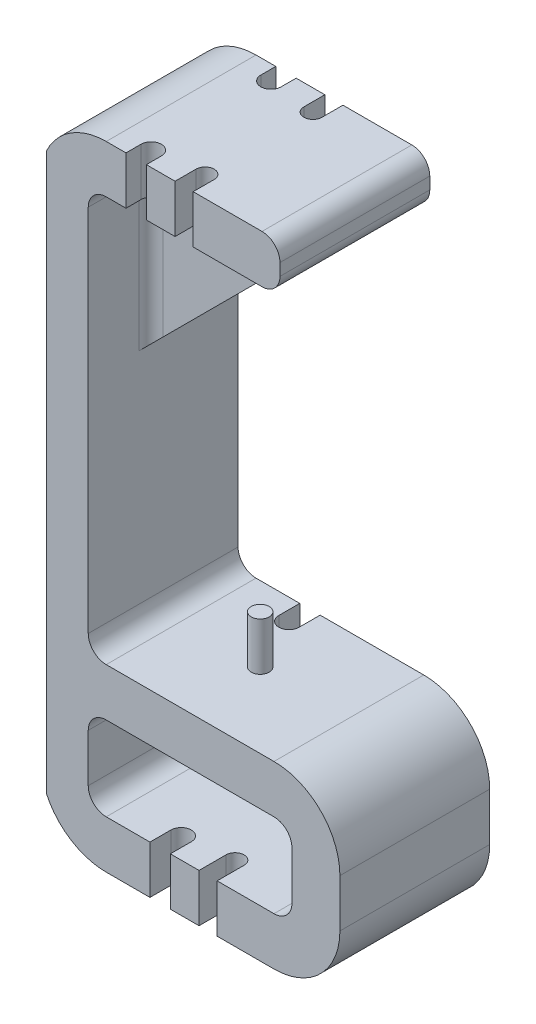
from build123d import *

# Parameters (mm, degrees)
BOSS_EXTRUDE2_DEPTH = 12.5
BOSS_EXTRUDE3_DEPTH = 25
FILLET3_R           = 3
FILLET4_R           = 11
CUT_EXTRUDE2_REACH  = 111.246
CUT_EXTRUDE3_REACH  = 111.246
CUT_EXTRUDE7_REACH  = 111.246
BOSS_EXTRUDE5_DEPTH = 2
FILLET6_R           = 2
FILLET7_R           = 3
CUT_EXTRUDE4_REACH  = 111.246
CUT_EXTRUDE6_REACH  = 111.246
SKETCH26_R          = 1.5
BOSS_EXTRUDE6_DEPTH = 8
CUT_EXTRUDE8_DEPTH  = 2
SKETCH30_W          = 25
SKETCH30_H          = 105.61
CUT_EXTRUDE9_DEPTH  = 1


with BuildPart() as part:
    # Sketch6 → Boss-Extrude2 (new, symmetric)
    with BuildSketch(Plane.XY):
        Polygon((-25, 52.805), (15, 52.805), (15, 44.805), (-17, 44.805), (-17, -44.805), (25, -44.805), (25, -52.805), (-25, -52.805), align=None)
    extrude(amount=BOSS_EXTRUDE2_DEPTH, both=True)

    # Sketch15 → Boss-Extrude3 (add)
    with BuildSketch(Plane.XY.offset(12.5)):
        Polygon((-17, -22.805), (25, -22.805), (25, -52.805), (17, -52.805), (17, -30.805), (-17, -30.805), align=None)
    extrude(amount=-BOSS_EXTRUDE3_DEPTH)

    # Fillet3
    fillet3_edges = [part.edges().sort_by_distance(p)[0] for p in [
        (-17, 44.805, 0),
        (-17, -44.805, 0),
        (17, -30.805, 0),
        (17, -44.805, 0),
        (-17, -22.805, 0),
        (-17, -30.805, 0),
    ]]
    fillet(fillet3_edges, radius=FILLET3_R)

    # Fillet4
    fillet4_edges = [part.edges().sort_by_distance(p)[0] for p in [
        (-25, 52.805, 0),
        (25, -52.805, 0),
        (-25, -52.805, 0),
        (25, -22.805, 0),
    ]]
    fillet(fillet4_edges, radius=FILLET4_R)

    # Sketch20 → Cut-Extrude2 (cut, up to next)
    with BuildSketch(Plane(origin=(0, 52.805, 0), x_dir=(1, 0, 0), z_dir=(0, 1, 0)), mode=Mode.PRIVATE) as cut_extrude2_sk1:
        with BuildLine():
            Line((-10.7, 12.5), (-10.7, 10))
            ThreePointArc((-10.7, 10), (-9, 8.3), (-7.3, 10))
            Line((-7.3, 10), (-7.3, 12.5))
            Line((-7.3, 12.5), (-10.7, 12.5))
        make_face()
    cut_extrude2_tool1 = extrude(cut_extrude2_sk1.sketch, amount=-CUT_EXTRUDE2_REACH, mode=Mode.PRIVATE) & part.part
    # Sketch20 → Cut-Extrude2 (cut, up to next)
    with BuildSketch(Plane(origin=(0, 52.805, 0), x_dir=(1, 0, 0), z_dir=(0, 1, 0)), mode=Mode.PRIVATE) as cut_extrude2_sk2:
        with BuildLine():
            Line((-7.3, -12.5), (-10.7, -12.5))
            Line((-10.7, -12.5), (-10.7, -10))
            ThreePointArc((-10.7, -10), (-9, -8.3), (-7.3, -10))
            Line((-7.3, -10), (-7.3, -12.5))
        make_face()
    cut_extrude2_tool2 = extrude(cut_extrude2_sk2.sketch, amount=-CUT_EXTRUDE2_REACH, mode=Mode.PRIVATE) & part.part
    add(cut_extrude2_tool1.solids().sort_by_distance((-9, 52.805, -10.563642))[0], mode=Mode.SUBTRACT)
    add(cut_extrude2_tool2.solids().sort_by_distance((-9, 52.805, 10.563642))[0], mode=Mode.SUBTRACT)

    # Cut-Extrude3: up to this face of the body (flat: up to its plane)
    cut_extrude3_end = Plane(part.part.faces().sort_by_distance((0, -22.805, 0))[0])
    # Sketch21 → Cut-Extrude3 (cut, up to the picked face)
    with BuildSketch(Plane.XZ.offset(52.805), mode=Mode.PRIVATE) as cut_extrude3_sk1:
        with BuildLine():
            Line((-3.3, -12.5), (-6.7, -12.5))
            Line((-6.7, -12.5), (-6.7, -9))
            ThreePointArc((-6.7, -9), (-5, -7.3), (-3.3, -9))
            Line((-3.3, -9), (-3.3, -12.5))
        make_face()
    cut_extrude3_tool1 = split(extrude(cut_extrude3_sk1.sketch, amount=-CUT_EXTRUDE3_REACH, mode=Mode.PRIVATE), bisect_by=cut_extrude3_end, keep=Keep.BOTH, mode=Mode.PRIVATE)
    add(cut_extrude3_tool1.solids().sort_by(Axis((-5, -52.805, -10.067524), (0, 1, 0)))[0], mode=Mode.SUBTRACT)

    # Sketch25 → Cut-Extrude7 (cut, up to next)
    with BuildSketch(Plane.XZ.offset(52.805), mode=Mode.PRIVATE) as cut_extrude7_sk1:
        with BuildLine():
            Line((-3.3, 9), (-3.3, 12.5))
            Line((-3.3, 12.5), (-6.7, 12.5))
            Line((-6.7, 12.5), (-6.7, 9))
            ThreePointArc((-6.7, 9), (-5, 7.3), (-3.3, 9))
        make_face()
    cut_extrude7_tool1 = extrude(cut_extrude7_sk1.sketch, amount=-CUT_EXTRUDE7_REACH, mode=Mode.PRIVATE) & part.part
    add(cut_extrude7_tool1.solids().sort_by_distance((-5, -52.805, 10.067524))[0], mode=Mode.SUBTRACT)

    # Sketch22 → Boss-Extrude5 (add, symmetric)
    with BuildSketch(Plane.XY):
        with BuildLine():
            Line((11, 44.805), (-17, 16.805))
            Line((-17, 16.805), (-17, 41.805))
            ThreePointArc((-17, 41.805), (-16.121320344, 43.926320344), (-14, 44.805))
            Line((-14, 44.805), (11, 44.805))
        make_face()
    extrude(amount=BOSS_EXTRUDE5_DEPTH, both=True)

    # Fillet6
    fillet6_edges = [part.edges().sort_by_distance(p)[0] for p in [
        (-1.5, 44.805, -2),
        (-16.121320344, 43.926320344, -2),
        (-17, 29.305, -2),
        (-1.5, 44.805, 2),
        (-16.121320344, 43.926320344, 2),
        (-17, 29.305, 2),
    ]]
    fillet(fillet6_edges, radius=FILLET6_R)

    # Fillet7
    fillet7_edges = [part.edges().sort_by_distance(p)[0] for p in [
        (15, 52.805, 0),
        (15, 44.805, 0),
    ]]
    fillet(fillet7_edges, radius=FILLET7_R)

    # Sketch23 → Cut-Extrude4 (cut, up to next)
    with BuildSketch(Plane(origin=(0, 52.805, 0), x_dir=(1, 0, 0), z_dir=(0, 1, 0)), mode=Mode.PRIVATE) as cut_extrude4_sk1:
        with BuildLine():
            Line((-2.51, 12.5), (-2.51, 9))
            ThreePointArc((-2.51, 9), (-1, 7.49), (0.51, 9))
            Line((0.51, 9), (0.51, 12.5))
            Line((0.51, 12.5), (-2.51, 12.5))
        make_face()
    cut_extrude4_tool1 = extrude(cut_extrude4_sk1.sketch, amount=-CUT_EXTRUDE4_REACH, mode=Mode.PRIVATE) & part.part
    # Sketch23 → Cut-Extrude4 (cut, up to next)
    with BuildSketch(Plane(origin=(0, 52.805, 0), x_dir=(1, 0, 0), z_dir=(0, 1, 0)), mode=Mode.PRIVATE) as cut_extrude4_sk2:
        with BuildLine():
            Line((0.51, -12.5), (-2.51, -12.5))
            Line((-2.51, -12.5), (-2.51, -9))
            ThreePointArc((-2.51, -9), (-1, -7.49), (0.51, -9))
            Line((0.51, -9), (0.51, -12.5))
        make_face()
    cut_extrude4_tool2 = extrude(cut_extrude4_sk2.sketch, amount=-CUT_EXTRUDE4_REACH, mode=Mode.PRIVATE) & part.part
    add(cut_extrude4_tool1.solids().sort_by_distance((-1, 52.805, -10.144905))[0], mode=Mode.SUBTRACT)
    add(cut_extrude4_tool2.solids().sort_by_distance((-1, 52.805, 10.144905))[0], mode=Mode.SUBTRACT)

    # Sketch24 → Cut-Extrude6 (cut, up to next)
    with BuildSketch(Plane.XZ.offset(52.805), mode=Mode.PRIVATE) as cut_extrude6_sk1:
        with BuildLine():
            Line((1.49, -12.5), (1.49, -8))
            ThreePointArc((1.49, -8), (3, -6.49), (4.51, -8))
            Line((4.51, -8), (4.51, -12.5))
            Line((4.51, -12.5), (1.49, -12.5))
        make_face()
    cut_extrude6_tool1 = extrude(cut_extrude6_sk1.sketch, amount=-CUT_EXTRUDE6_REACH, mode=Mode.PRIVATE) & part.part
    # Sketch24 → Cut-Extrude6 (cut, up to next)
    with BuildSketch(Plane.XZ.offset(52.805), mode=Mode.PRIVATE) as cut_extrude6_sk2:
        with BuildLine():
            Line((4.51, 12.5), (1.49, 12.5))
            Line((1.49, 12.5), (1.49, 8))
            ThreePointArc((1.49, 8), (3, 6.49), (4.51, 8))
            Line((4.51, 8), (4.51, 12.5))
        make_face()
    cut_extrude6_tool2 = extrude(cut_extrude6_sk2.sketch, amount=-CUT_EXTRUDE6_REACH, mode=Mode.PRIVATE) & part.part
    add(cut_extrude6_tool1.solids().sort_by_distance((3, -52.805, -9.647036))[0], mode=Mode.SUBTRACT)
    add(cut_extrude6_tool2.solids().sort_by_distance((3, -52.805, 9.647036))[0], mode=Mode.SUBTRACT)

    # Sketch26 → Boss-Extrude6 (add)
    with BuildSketch(Plane(origin=(0, -22.805, 0), x_dir=(1, 0, 0), z_dir=(0, 1, 0))):
        with Locations(Location((-0.8, 0, 0), (0, 0, 270))):
            Circle(SKETCH26_R)
    extrude(amount=BOSS_EXTRUDE6_DEPTH)

    # Sketch29 → Cut-Extrude8 (cut)
    with BuildSketch(Plane.ZY.offset(25)):
        Polygon((1.25, 37.916111111), (2.5, 37.916111111), (2.256944444, 37.638333333), (1.423611111, 37.638333333), align=None)
        Polygon((0, 37.916111111), (1.180555556, 37.916111111), (1.006944444, 37.638333333), (0.243055556, 37.638333333), align=None)
        Polygon((1.180555556, 36.4925), (0, 36.4925), (0.243055556, 36.770277778), (1.006944444, 36.770277778), align=None)
        Polygon((2.5, 36.4925), (1.25, 36.4925), (1.423611111, 36.770277778), (2.256944444, 36.770277778), align=None)
        Polygon((1.216362847, 37.811944444), (1.355251736, 37.603611111), (1.355251736, 36.805), (1.217447917, 36.596666667), (1.077473958, 36.805), (1.077473958, 37.603611111), align=None)
        Polygon((1.041666667, 35.207777778), (0.243055556, 35.207777778), (0, 35.345581597), (0.243055556, 35.485555556), (1.041666667, 35.485555556), align=None)
        Polygon((2.5, 36.075833333), (2.256944444, 35.798055556), (1.423611111, 35.798055556), (1.306966146, 36.054674479), (1.319444444, 36.075833333), align=None)
        Polygon((2.5, 34.6175), (1.319444444, 34.6175), (1.306966146, 34.638658854), (1.423611111, 34.895277778), (2.256944444, 34.895277778), align=None)
        Polygon((1.251085069, 35.971666667), (1.388888889, 35.763333333), (1.388888889, 34.93), (1.251085069, 34.721666667), (1.111111111, 34.93), (1.111111111, 35.763333333), align=None)
        Polygon((1.284722222, 34.235555556), (2.465277778, 34.235555556), (2.1875, 33.957777778), (1.458333333, 33.957777778), align=None)
        Polygon((0, 34.235555556), (1.215277778, 34.235555556), (1.041666667, 33.957777778), (0.243055556, 33.957777778), align=None)
        Polygon((2.5, 33.124444444), (2.362196181, 33.020277778), (2.222222222, 33.124444444), (2.222222222, 33.923055556), (2.5, 34.200833333), align=None)
        Polygon((2.1875, 32.811944444), (1.319444444, 32.811944444), (1.306966146, 32.833103299), (1.458333333, 33.089722222), (2.1875, 33.089722222), (2.291666667, 32.951918403), align=None)
        Polygon((1.251085069, 34.131388889), (1.389973958, 33.923055556), (1.389973958, 33.124444444), (1.252170139, 32.916111111), (1.112196181, 33.124444444), (1.112196181, 33.923055556), align=None)
        Polygon((1.284722222, 32.291111111), (2.430555556, 32.291111111), (2.1875, 32.013333333), (1.458333333, 32.013333333), align=None)
        Polygon((0.069444444, 32.291111111), (1.215277778, 32.291111111), (1.041666667, 32.013333333), (0.3125, 32.013333333), align=None)
        Polygon((2.5, 30.971666667), (2.222222222, 31.249444444), (2.222222222, 31.978611111), (2.5, 32.256388889), align=None)
        Polygon((0, 30.971666667), (0, 32.256388889), (0.277777778, 31.978611111), (0.277777778, 31.249444444), align=None)
        Polygon((1.251085069, 32.186944444), (1.389973958, 31.978611111), (1.389973958, 31.249444444), (1.251085069, 31.006388889), (1.112196181, 31.249444444), (1.112196181, 31.978611111), align=None)
        Polygon((0.999348958, 29.443888889), (-0.025499132, 29.009861111), (0.243055556, 29.415677083), (0.999348958, 29.740655382), align=None)
        Polygon((1.284722222, 30.589722222), (2.465277778, 30.589722222), (2.1875, 30.311944444), (1.458333333, 30.311944444), align=None)
        Polygon((-0.034722222, 30.589722222), (1.215277778, 30.589722222), (1.041666667, 30.311944444), (0.243055556, 30.311944444), align=None)
        Polygon((2.5, 29.513333333), (2.362196181, 29.409166667), (2.222222222, 29.513333333), (2.222222222, 30.277222222), (2.5, 30.555), align=None)
        Polygon((2.1875, 29.200833333), (1.319444444, 29.200833333), (1.306966146, 29.221992187), (1.458333333, 29.478611111), (2.1875, 29.478611111), (2.291666667, 29.340807292), align=None)
        Polygon((1.251085069, 30.52624566), (1.389973958, 30.277222222), (1.389973958, 29.513333333), (1.252170139, 29.305), (1.112196181, 29.513333333), (1.112196181, 30.277222222), align=None)
        Polygon((1.255967882, 28.575833333), (1.388888889, 28.311076389), (1.388888889, 27.703980035), (1.255967882, 27.43), (1.111111111, 27.703980035), (1.111111111, 28.311076389), align=None)
        Polygon((2.465277778, 25.450833333), (2.259657118, 25.450833333), (1.423611111, 26.28796441), (1.423611111, 26.4925), (1.629231771, 26.4925), (2.465277778, 25.655368924), align=None)
        Polygon((1.25, 26.874444444), (2.5, 26.874444444), (2.256944444, 26.596666667), (1.423611111, 26.596666667), align=None)
        Polygon((0, 26.874444444), (1.180555556, 26.874444444), (1.006944444, 26.596666667), (0.243055556, 26.596666667), align=None)
        Polygon((0.243055556, 25.728611111), (1.041666667, 25.728611111), (1.158311632, 25.471992187), (1.145833333, 25.450833333), (0, 25.450833333), align=None)
        Polygon((1.216362847, 26.770277778), (1.355251736, 26.561944444), (1.355251736, 25.763333333), (1.217447917, 25.555), (1.077473958, 25.763333333), (1.077473958, 26.561944444), align=None)
        Polygon((1.284722222, 23.089722222), (2.150607639, 23.089722222), (2.291666667, 22.949748264), (2.1875, 22.811944444), (1.458333333, 22.811944444), align=None)
        Polygon((0.347764757, 23.089722222), (1.215277778, 23.089722222), (1.041666667, 22.811944444), (0.3125, 22.811944444), (0.208333333, 22.949748264), align=None)
        Polygon((2.5, 21.735555556), (2.222222222, 22.013333333), (2.222222222, 22.777222222), (2.362196181, 22.881388889), (2.5, 22.777222222), align=None)
        Polygon((0, 21.735555556), (0, 22.777222222), (0.139973958, 22.881388889), (0.277777778, 22.777222222), (0.277777778, 22.013333333), align=None)
        Polygon((1.284722222, 21.353611111), (2.430555556, 21.353611111), (2.1875, 21.075833333), (1.458333333, 21.075833333), align=None)
        Polygon((0, 21.353611111), (1.215277778, 21.353611111), (1.041666667, 21.075833333), (0.243055556, 21.075833333), align=None)
        Polygon((2.5, 19.999444444), (2.222222222, 20.2425), (2.222222222, 21.041111111), (2.5, 21.284166667), align=None)
        Polygon((1.215277778, 19.93), (0, 19.93), (0.243055556, 20.207777778), (1.041666667, 20.207777778), align=None)
        Polygon((2.430555556, 19.93), (1.284722222, 19.93), (1.458333333, 20.207777778), (2.1875, 20.207777778), align=None)
        Polygon((1.251085069, 21.249444444), (1.389973958, 21.041111111), (1.389973958, 20.2425), (1.252170139, 20.034166667), (1.112196181, 20.2425), (1.112196181, 21.041111111), align=None)
        Polygon((1.284722222, 19.513333333), (2.1875, 19.513333333), (2.291666667, 19.373359375), (2.1875, 19.235555556), (1.458333333, 19.235555556), align=None)
        Polygon((0, 19.513333333), (1.215277778, 19.513333333), (1.041666667, 19.235555556), (0.243055556, 19.235555556), align=None)
        Polygon((2.5, 18.402222222), (2.362196181, 18.298055556), (2.222222222, 18.402222222), (2.222222222, 19.200833333), (2.362196181, 19.305), (2.5, 19.200833333), align=None)
        Polygon((1.215277778, 18.089722222), (0, 18.089722222), (0.243055556, 18.3675), (1.041666667, 18.3675), align=None)
        Polygon((2.1875, 18.089722222), (1.284722222, 18.089722222), (1.458333333, 18.3675), (2.1875, 18.3675), (2.291666667, 18.229696181), align=None)
        Polygon((1.284722222, 17.673055556), (2.430555556, 17.673055556), (2.1875, 17.395277778), (1.458333333, 17.395277778), align=None)
        Polygon((0, 17.673055556), (1.215277778, 17.673055556), (1.041666667, 17.395277778), (0.243055556, 17.395277778), align=None)
        Polygon((2.5, 16.318888889), (2.222222222, 16.561944444), (2.222222222, 17.360555556), (2.5, 17.603611111), align=None)
        Polygon((1.215277778, 16.249444444), (0, 16.249444444), (0.243055556, 16.527222222), (1.041666667, 16.527222222), align=None)
        Polygon((2.430555556, 16.249444444), (1.284722222, 16.249444444), (1.458333333, 16.527222222), (2.1875, 16.527222222), align=None)
        Polygon((1.251085069, 17.568888889), (1.389973958, 17.360555556), (1.389973958, 16.561944444), (1.252170139, 16.353611111), (1.112196181, 16.561944444), (1.112196181, 17.360555556), align=None)
        Polygon((1.284722222, 15.832777778), (2.430555556, 15.832777778), (2.1875, 15.555), (1.458333333, 15.555), align=None)
        Polygon((0.069444444, 15.832777778), (1.215277778, 15.832777778), (1.041666667, 15.555), (0.3125, 15.555), align=None)
        Polygon((2.5, 14.721666667), (2.362196181, 14.6175), (2.222222222, 14.721666667), (2.222222222, 15.520277778), (2.5, 15.798055556), align=None)
        Polygon((0, 14.721666667), (0, 15.798055556), (0.277777778, 15.520277778), (0.277777778, 14.721666667), (0.139973958, 14.6175), align=None)
        Polygon((1.215277778, 14.409166667), (0.3125, 14.409166667), (0.208333333, 14.549140625), (0.3125, 14.686944444), (1.041666667, 14.686944444), align=None)
        Polygon((2.1875, 14.409166667), (1.284722222, 14.409166667), (1.458333333, 14.686944444), (2.1875, 14.686944444), (2.291666667, 14.549140625), align=None)
        Polygon((1.284722222, 13.9925), (2.430555556, 13.9925), (2.1875, 13.714722222), (1.458333333, 13.714722222), align=None)
        Polygon((0, 13.9925), (1.215277778, 13.9925), (1.041666667, 13.714722222), (0.243055556, 13.714722222), align=None)
        Polygon((2.5, 12.638333333), (2.222222222, 12.881388889), (2.222222222, 13.68), (2.5, 13.923055556), align=None)
        Polygon((1.215277778, 12.568888889), (0, 12.568888889), (0.243055556, 12.846666667), (1.041666667, 12.846666667), align=None)
        Polygon((2.430555556, 12.568888889), (1.284722222, 12.568888889), (1.458333333, 12.846666667), (2.1875, 12.846666667), align=None)
        Polygon((1.251085069, 13.888333333), (1.389973958, 13.68), (1.389973958, 12.881388889), (1.252170139, 12.673055556), (1.112196181, 12.881388889), (1.112196181, 13.68), align=None)
        Polygon((1.255967882, 10.173055556), (1.388888889, 9.908298611), (1.388888889, 9.301202257), (1.255967882, 9.027222222), (1.111111111, 9.301202257), (1.111111111, 9.908298611), align=None)
        Polygon((1.284722222, 6.631388889), (2.465277778, 6.631388889), (2.1875, 6.353611111), (1.458333333, 6.353611111), align=None)
        Polygon((0, 6.631388889), (1.215277778, 6.631388889), (1.041666667, 6.353611111), (0.243055556, 6.353611111), align=None)
        Polygon((2.5, 5.520277778), (2.362196181, 5.416111111), (2.222222222, 5.520277778), (2.222222222, 6.318888889), (2.5, 6.596666667), align=None)
        Polygon((2.1875, 5.207777778), (1.319444444, 5.207777778), (1.306966146, 5.228936632), (1.458333333, 5.485555556), (2.1875, 5.485555556), (2.291666667, 5.347751736), align=None)
        Polygon((1.251085069, 6.527222222), (1.389973958, 6.318888889), (1.389973958, 5.520277778), (1.252170139, 5.311944444), (1.112196181, 5.520277778), (1.112196181, 6.318888889), align=None)
        Polygon((1.180555556, 3.923055556), (0, 3.923055556), (0.243055556, 4.200833333), (1.006944444, 4.200833333), align=None)
        Polygon((2.5, 3.923055556), (1.25, 3.923055556), (1.423611111, 4.200833333), (2.256944444, 4.200833333), align=None)
        Polygon((0.069444444, 1.4925), (0.3125, 1.770277778), (0.555555556, 1.770277778), (0.729166667, 1.4925), align=None)
        Polygon((0, 2.846666667), (0.277777778, 2.568888889), (0.277777778, 1.805), (0, 1.527222222), align=None)
        Polygon((1.180555556, 2.881388889), (1.006944444, 2.603611111), (0.3125, 2.603611111), (0.069444444, 2.881388889), align=None)
        Polygon((2.5, 2.881388889), (2.256944444, 2.603611111), (1.423611111, 2.603611111), (1.25, 2.881388889), align=None)
        Polygon((0.069444444, -0.347777778), (0.3125, -0.07), (0.555555556, -0.07), (0.729166667, -0.347777778), align=None)
        Polygon((0, 1.006388889), (0.277777778, 0.728611111), (0.277777778, -0.035277778), (0, -0.313055556), align=None)
        Polygon((1.180555556, 1.041111111), (1.006944444, 0.763333333), (0.3125, 0.763333333), (0.069444444, 1.041111111), align=None)
        Polygon((2.5, 1.041111111), (2.256944444, 0.763333333), (1.423611111, 0.763333333), (1.25, 1.041111111), align=None)
        Polygon((1.284722222, -0.729722222), (2.430555556, -0.729722222), (2.1875, -1.0075), (1.458333333, -1.0075), align=None)
        Polygon((0, -0.729722222), (1.215277778, -0.729722222), (1.041666667, -1.0075), (0.243055556, -1.0075), align=None)
        Polygon((2.5, -2.083888889), (2.222222222, -1.840833333), (2.222222222, -1.042222222), (2.5, -0.799166667), align=None)
        Polygon((1.215277778, -2.153333333), (0, -2.153333333), (0.243055556, -1.875555556), (1.041666667, -1.875555556), align=None)
        Polygon((2.430555556, -2.153333333), (1.284722222, -2.153333333), (1.458333333, -1.875555556), (2.1875, -1.875555556), align=None)
        Polygon((1.251085069, -0.833888889), (1.389973958, -1.042222222), (1.389973958, -1.840833333), (1.252170139, -2.049166667), (1.112196181, -1.840833333), (1.112196181, -1.042222222), align=None)
        Polygon((0.999348958, -3.681111111), (-0.025499132, -4.115138889), (0.243055556, -3.709322917), (0.999348958, -3.384344618), align=None)
        Polygon((1.284722222, -2.535277778), (2.465277778, -2.535277778), (2.1875, -2.813055556), (1.458333333, -2.813055556), align=None)
        Polygon((-0.034722222, -2.535277778), (1.215277778, -2.535277778), (1.041666667, -2.813055556), (0.243055556, -2.813055556), align=None)
        Polygon((2.5, -3.611666667), (2.362196181, -3.715833333), (2.222222222, -3.611666667), (2.222222222, -2.847777778), (2.5, -2.57), align=None)
        Polygon((2.1875, -3.924166667), (1.319444444, -3.924166667), (1.306966146, -3.903007813), (1.458333333, -3.646388889), (2.1875, -3.646388889), (2.291666667, -3.784192708), align=None)
        Polygon((1.251085069, -2.59875434), (1.389973958, -2.847777778), (1.389973958, -3.611666667), (1.252170139, -3.82), (1.112196181, -3.611666667), (1.112196181, -2.847777778), align=None)
        Polygon((1.136067708, -6.597777778), (0.3125, -6.927638889), (0.034722222, -6.719305556), (1.215277778, -6.250555556), align=None)
        Polygon((0, -7.205416667), (0, -6.754027778), (0.243055556, -6.976467014), align=None)
        Polygon((1.215277778, -7.674166667), (0.069444444, -7.240138889), (0.3125, -7.031805556), (1.121419271, -7.361666667), align=None)
        Polygon((1.25, -6.250555556), (2.5, -6.250555556), (2.256944444, -6.528333333), (1.423611111, -6.528333333), align=None)
        Polygon((2.5, -7.674166667), (1.25, -7.674166667), (1.423611111, -7.396388889), (2.256944444, -7.396388889), align=None)
        Polygon((0.069444444, -8.090833333), (1.180555556, -8.090833333), (1.193033854, -8.111992188), (1.041666667, -8.368611111), (0.3125, -8.368611111), align=None)
        Polygon((2.5, -9.479722222), (2.222222222, -9.201944444), (2.222222222, -8.403333333), (2.5, -8.160277778), align=None)
        Polygon((0, -9.479722222), (0, -8.125555556), (0.277777778, -8.403333333), (0.277777778, -9.201944444), align=None)
        Polygon((2.430555556, -9.514444444), (1.284722222, -9.514444444), (1.272243924, -9.49328559), (1.423611111, -9.236666667), (2.1875, -9.236666667), align=None)
        Polygon((1.234809028, -8.195), (1.372612847, -8.403333333), (1.372612847, -9.201944444), (1.233723958, -9.452595486), (1.094835069, -9.201944444), (1.094835069, -8.403333333), align=None)
        Polygon((0.623372396, -10.799166667), (0, -10.799166667), (0.067274306, -10.521388889), (0.520833333, -10.521388889), align=None)
        Polygon((2.5, -12.743611111), (2.222222222, -12.465833333), (2.222222222, -12.279201389), (2.5, -11.991657986), align=None)
        Polygon((1.215277778, -12.778333333), (0, -12.778333333), (0.243055556, -12.500555556), (1.041666667, -12.500555556), align=None)
        Polygon((2.430555556, -12.778333333), (1.284722222, -12.778333333), (1.458333333, -12.500555556), (2.1875, -12.500555556), align=None)
        Polygon((1.255967882, -15.590833333), (1.388888889, -15.855590278), (1.388888889, -16.462686632), (1.255967882, -16.736666667), (1.111111111, -16.462686632), (1.111111111, -15.855590278), align=None)
        Polygon((2.5, -20.417222222), (2.222222222, -20.139444444), (2.222222222, -19.410277778), (2.5, -19.1325), align=None)
        Polygon((0, -20.417222222), (0, -19.1325), (0.277777778, -19.410277778), (0.277777778, -20.139444444), align=None)
        Polygon((1.215277778, -20.451944444), (0.069444444, -20.451944444), (0.3125, -20.174166667), (1.043836806, -20.174166667), align=None)
        Polygon((2.430555556, -20.451944444), (1.284722222, -20.451944444), (1.456163194, -20.174166667), (2.1875, -20.174166667), align=None)
        Polygon((1.252170139, -19.167222222), (1.389973958, -19.410277778), (1.389973958, -20.139444444), (1.251085069, -20.388467882), (1.112196181, -20.139444444), (1.112196181, -19.410277778), align=None)
        Polygon((1.284722222, -20.972777778), (2.430555556, -20.972777778), (2.1875, -21.250555556), (1.458333333, -21.250555556), align=None)
        Polygon((0.069444444, -20.972777778), (1.215277778, -20.972777778), (1.041666667, -21.250555556), (0.3125, -21.250555556), align=None)
        Polygon((2.5, -22.361666667), (2.222222222, -22.083888889), (2.222222222, -21.285277778), (2.5, -21.0075), align=None)
        Polygon((0, -22.361666667), (0, -21.0075), (0.277777778, -21.285277778), (0.277777778, -22.083888889), align=None)
        Polygon((1.215277778, -22.396388889), (0.069444444, -22.396388889), (0.3125, -22.118611111), (1.041666667, -22.118611111), align=None)
        Polygon((2.430555556, -22.396388889), (1.284722222, -22.396388889), (1.458333333, -22.118611111), (2.1875, -22.118611111), align=None)
        Polygon((0.997721354, -23.60515625), (-0.383029514, -22.719739583), (-0.452473958, -22.500555556), (-0.214301215, -22.500555556), (0.997721354, -23.281805556), align=None)
        Polygon((1.014539931, -23.594305556), (1.295572917, -23.449991319), (2.603081597, -24.280069444), (2.703993056, -24.530177951), (2.503255208, -24.549166667), align=None)
        Polygon((0.069444444, -24.618611111), (0.729166667, -24.618611111), (0.555555556, -24.896388889), (0.3125, -24.896388889), align=None)
        Polygon((0, -25.972777778), (0, -24.653333333), (0.277777778, -24.931111111), (0.277777778, -25.695), align=None)
        Polygon((1.180555556, -26.0075), (0.069444444, -26.0075), (0.3125, -25.729722222), (1.006944444, -25.729722222), align=None)
        Polygon((2.5, -26.0075), (1.25, -26.0075), (1.423611111, -25.729722222), (2.256944444, -25.729722222), align=None)
        Polygon((1.180555556, -27.917222222), (0.3125, -27.917222222), (0.208333333, -27.777248264), (0.3125, -27.639444444), (1.006944444, -27.639444444), align=None)
        Polygon((2.5, -27.917222222), (1.25, -27.917222222), (1.423611111, -27.639444444), (2.256944444, -27.639444444), align=None)
        Polygon((0, -26.806111111), (0.139973958, -26.667222222), (0.277777778, -26.806111111), (0.277777778, -27.604722222), (0.139973958, -27.743611111), (0, -27.604722222), align=None)
        Polygon((1.25, -26.493611111), (2.5, -26.493611111), (2.256944444, -26.771388889), (1.423611111, -26.771388889), align=None)
        Polygon((0.3125, -26.493611111), (1.180555556, -26.493611111), (1.006944444, -26.771388889), (0.3125, -26.771388889), (0.208333333, -26.633585069), align=None)
        Polygon((0.069444444, -29.792222222), (0.3125, -29.514444444), (0.555555556, -29.514444444), (0.729166667, -29.792222222), align=None)
        Polygon((0, -28.438055556), (0.277777778, -28.715833333), (0.277777778, -29.479722222), (0, -29.7575), align=None)
        Polygon((1.180555556, -28.403333333), (1.006944444, -28.681111111), (0.3125, -28.681111111), (0.069444444, -28.403333333), align=None)
        Polygon((2.5, -28.403333333), (2.256944444, -28.681111111), (1.423611111, -28.681111111), (1.25, -28.403333333), align=None)
        Polygon((0.997721354, -30.966267361), (-0.383029514, -30.080850694), (-0.452473958, -29.861666667), (-0.214301215, -29.861666667), (0.997721354, -30.642916667), align=None)
        Polygon((1.014539931, -30.955416667), (1.295572917, -30.811102431), (2.603081597, -31.641180556), (2.703993056, -31.891289063), (2.503255208, -31.910277778), align=None)
        Polygon((0.069444444, -32.014444444), (1.180555556, -32.014444444), (1.193033854, -32.035603299), (1.041666667, -32.292222222), (0.3125, -32.292222222), align=None)
        Polygon((2.5, -33.403333333), (2.222222222, -33.125555556), (2.222222222, -32.326944444), (2.5, -32.083888889), align=None)
        Polygon((0, -33.403333333), (0, -32.049166667), (0.277777778, -32.326944444), (0.277777778, -33.125555556), align=None)
        Polygon((2.430555556, -33.438055556), (1.284722222, -33.438055556), (1.272243924, -33.416896701), (1.423611111, -33.160277778), (2.1875, -33.160277778), align=None)
        Polygon((1.234809028, -32.118611111), (1.372612847, -32.326944444), (1.372612847, -33.125555556), (1.233723958, -33.376206597), (1.094835069, -33.125555556), (1.094835069, -32.326944444), align=None)
        Polygon((1.284722222, -33.854722222), (2.430555556, -33.854722222), (2.1875, -34.1325), (1.458333333, -34.1325), align=None)
        Polygon((0.069444444, -33.854722222), (1.215277778, -33.854722222), (1.041666667, -34.1325), (0.3125, -34.1325), align=None)
        Polygon((2.5, -35.243611111), (2.222222222, -34.965833333), (2.222222222, -34.167222222), (2.5, -33.889444444), align=None)
        Polygon((0, -35.243611111), (0, -33.889444444), (0.277777778, -34.167222222), (0.277777778, -34.965833333), align=None)
        Polygon((1.215277778, -35.278333333), (0.069444444, -35.278333333), (0.3125, -35.000555556), (1.041666667, -35.000555556), align=None)
        Polygon((2.430555556, -35.278333333), (1.284722222, -35.278333333), (1.458333333, -35.000555556), (2.1875, -35.000555556), align=None)
        Polygon((2.5, -36.667222222), (2.222222222, -36.389444444), (2.222222222, -36.2028125), (2.5, -35.915269097), align=None)
        Polygon((1.215277778, -36.701944444), (0, -36.701944444), (0.243055556, -36.424166667), (1.041666667, -36.424166667), align=None)
        Polygon((2.430555556, -36.701944444), (1.284722222, -36.701944444), (1.458333333, -36.424166667), (2.1875, -36.424166667), align=None)
        Polygon((2.430555556, -37.500555556), (2.1875, -37.778333333), (1.458333333, -37.778333333), (1.306966146, -37.52171441), (1.319444444, -37.500555556), align=None)
        Polygon((2.5, -38.854722222), (2.222222222, -38.576944444), (2.222222222, -37.813055556), (2.5, -37.535277778), align=None)
        Polygon((0, -38.854722222), (0, -37.535277778), (0.277777778, -37.813055556), (0.277777778, -38.576944444), align=None)
        Polygon((1.215277778, -38.889444444), (0.069444444, -38.889444444), (0.3125, -38.611666667), (1.041666667, -38.611666667), align=None)
        Polygon((2.475043403, -38.889444444), (1.284722222, -38.889444444), (1.458333333, -38.611666667), (2.1875, -38.611666667), align=None)
        Polygon((1.252170139, -37.564032118), (1.389973958, -37.813055556), (1.389973958, -38.576944444), (1.251085069, -38.827595486), (1.112196181, -38.576944444), (1.112196181, -37.813055556), align=None)
    extrude(amount=-CUT_EXTRUDE8_DEPTH, mode=Mode.SUBTRACT)

    # Sketch30 → Cut-Extrude9 (cut)
    with BuildSketch(Plane.ZY.offset(25)):
        Rectangle(SKETCH30_W, SKETCH30_H)
    extrude(amount=-CUT_EXTRUDE9_DEPTH, mode=Mode.SUBTRACT)


solid = part.part
